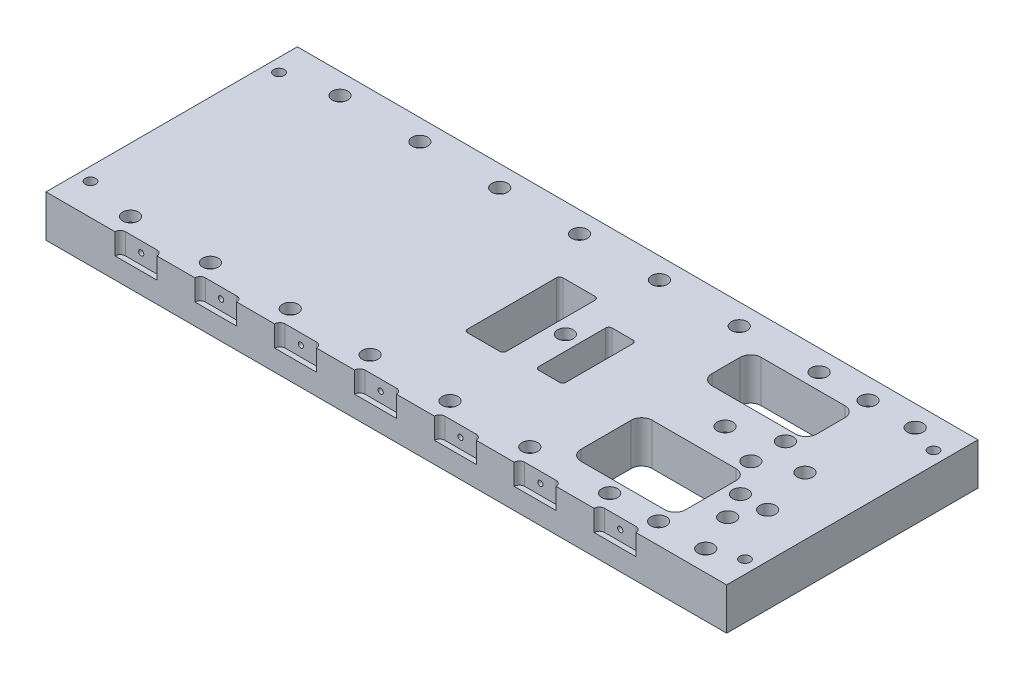
from build123d import *

# Parameters (mm, degrees)
SKETCH1_W                    = 650
SKETCH1_H                    = 240
BOSS_EXTRUDE1_DEPTH          = 40
CUT_EXTRUDE2_REACH           = 350.748
SKETCH3_R                    = 7.5
SKETCH4_R                    = 9
CUT_EXTRUDE3_DEPTH           = 5
SKETCH11_R                   = 7.5
CUT_EXTRUDE9_DEPTH           = 643.21019682
SKETCH12_R                   = 10
CUT_EXTRUDE10_DEPTH          = 5
SKETCH13_R                   = 10
CUT_EXTRUDE11_DEPTH          = 30
M10_TAPPED_HOLE1_D           = 8.5
M10_TAPPED_HOLE1_DEPTH       = 27.5
M10_TAPPED_HOLE1_CSINK_D     = 10.05
M10_TAPPED_HOLE1_CSINK_ANGLE = 90
M10_TAPPED_HOLE1_TIP         = 2.553657631
F_10_0MM_DOWEL_HOLE2_D       = 10
CUT_EXTRUDE12_REACH          = 350.748
SKETCH28_R                   = 7.5
SKETCH29_R                   = 9
CUT_EXTRUDE13_DEPTH          = 30
CUT_EXTRUDE14_DEPTH          = 20
LPATTERN1_COUNT              = 7
LPATTERN1_PITCH              = 76.25
CUT_EXTRUDE15_REACH          = 350.748
CUT_EXTRUDE16_REACH          = 350.748


with BuildPart() as part:
    # Sketch1 → Boss-Extrude1 (new body)
    with BuildSketch(Plane(origin=(0, 0, 0), x_dir=(1, 0, 0), z_dir=(0, 1, 0))):
        Rectangle(SKETCH1_W, SKETCH1_H)
    extrude(amount=-BOSS_EXTRUDE1_DEPTH)

    # Sketch3 → Cut-Extrude2 (cut, up to next)
    with BuildSketch(Plane(origin=(0, 0, 0), x_dir=(1, 0, 0), z_dir=(0, 1, 0)), mode=Mode.PRIVATE) as cut_extrude2_sk1:
        with Locations((234.38, 26.73)):
            Circle(SKETCH3_R)
    cut_extrude2_tool1 = extrude(cut_extrude2_sk1.sketch, amount=-CUT_EXTRUDE2_REACH, mode=Mode.PRIVATE) & part.part
    # Sketch3 → Cut-Extrude2 (cut, up to next)
    with BuildSketch(Plane(origin=(0, 0, 0), x_dir=(1, 0, 0), z_dir=(0, 1, 0)), mode=Mode.PRIVATE) as cut_extrude2_sk2:
        with Locations((234.38, -6.27)):
            Circle(SKETCH3_R)
    cut_extrude2_tool2 = extrude(cut_extrude2_sk2.sketch, amount=-CUT_EXTRUDE2_REACH, mode=Mode.PRIVATE) & part.part
    # Sketch3 → Cut-Extrude2 (cut, up to next)
    with BuildSketch(Plane(origin=(0, 0, 0), x_dir=(1, 0, 0), z_dir=(0, 1, 0)), mode=Mode.PRIVATE) as cut_extrude2_sk3:
        with Locations((269.5, -63.53)):
            Circle(SKETCH3_R)
    cut_extrude2_tool3 = extrude(cut_extrude2_sk3.sketch, amount=-CUT_EXTRUDE2_REACH, mode=Mode.PRIVATE) & part.part
    # Sketch3 → Cut-Extrude2 (cut, up to next)
    with BuildSketch(Plane(origin=(0, 0, 0), x_dir=(1, 0, 0), z_dir=(0, 1, 0)), mode=Mode.PRIVATE) as cut_extrude2_sk4:
        with Locations((282.5, -38.4)):
            Circle(SKETCH3_R)
    cut_extrude2_tool4 = extrude(cut_extrude2_sk4.sketch, amount=-CUT_EXTRUDE2_REACH, mode=Mode.PRIVATE) & part.part
    # Sketch3 → Cut-Extrude2 (cut, up to next)
    with BuildSketch(Plane(origin=(0, 0, 0), x_dir=(1, 0, 0), z_dir=(0, 1, 0)), mode=Mode.PRIVATE) as cut_extrude2_sk5:
        with Locations((256.5, -38.4)):
            Circle(SKETCH3_R)
    cut_extrude2_tool5 = extrude(cut_extrude2_sk5.sketch, amount=-CUT_EXTRUDE2_REACH, mode=Mode.PRIVATE) & part.part
    # Sketch3 → Cut-Extrude2 (cut, up to next)
    with BuildSketch(Plane(origin=(0, 0, 0), x_dir=(1, 0, 0), z_dir=(0, 1, 0)), mode=Mode.PRIVATE) as cut_extrude2_sk6:
        with BuildLine():
            Line((153.25, 84.63), (233.25, 84.63))
            ThreePointArc((233.25, 84.63), (240.321067812, 81.701067812), (243.25, 74.63))
            Line((243.25, 74.63), (243.25, 47.63))
            ThreePointArc((243.25, 47.63), (240.321067812, 40.558932188), (233.25, 37.63))
            Line((233.25, 37.63), (153.25, 37.63))
            ThreePointArc((153.25, 37.63), (146.178932188, 40.558932188), (143.25, 47.63))
            Line((143.25, 47.63), (143.25, 74.63))
            ThreePointArc((143.25, 74.63), (146.178932188, 81.701067812), (153.25, 84.63))
        make_face()
    cut_extrude2_tool6 = extrude(cut_extrude2_sk6.sketch, amount=-CUT_EXTRUDE2_REACH, mode=Mode.PRIVATE) & part.part
    # Sketch3 → Cut-Extrude2 (cut, up to next)
    with BuildSketch(Plane(origin=(0, 0, 0), x_dir=(1, 0, 0), z_dir=(0, 1, 0)), mode=Mode.PRIVATE) as cut_extrude2_sk7:
        with BuildLine():
            Line((153.25, -19.4), (233.25, -19.4))
            ThreePointArc((233.25, -19.4), (240.321067812, -22.328932188), (243.25, -29.4))
            Line((243.25, -29.4), (243.25, -77.4))
            ThreePointArc((243.25, -77.4), (240.321067812, -84.471067812), (233.25, -87.4))
            Line((233.25, -87.4), (153.25, -87.4))
            ThreePointArc((153.25, -87.4), (146.178932188, -84.471067812), (143.25, -77.4))
            Line((143.25, -77.4), (143.25, -29.4))
            ThreePointArc((143.25, -29.4), (146.178932188, -22.328932188), (153.25, -19.4))
        make_face()
    cut_extrude2_tool7 = extrude(cut_extrude2_sk7.sketch, amount=-CUT_EXTRUDE2_REACH, mode=Mode.PRIVATE) & part.part
    add(cut_extrude2_tool1.solids().sort_by_distance((234.38, 0, -26.73))[0], mode=Mode.SUBTRACT)
    add(cut_extrude2_tool2.solids().sort_by_distance((234.38, 0, 6.27))[0], mode=Mode.SUBTRACT)
    add(cut_extrude2_tool3.solids().sort_by_distance((269.5, 0, 63.53))[0], mode=Mode.SUBTRACT)
    add(cut_extrude2_tool4.solids().sort_by_distance((282.5, 0, 38.4))[0], mode=Mode.SUBTRACT)
    add(cut_extrude2_tool5.solids().sort_by_distance((256.5, 0, 38.4))[0], mode=Mode.SUBTRACT)
    add(cut_extrude2_tool6.solids().sort_by_distance((193.25, 0, -61.13))[0], mode=Mode.SUBTRACT)
    add(cut_extrude2_tool7.solids().sort_by_distance((193.25, 0, 53.4))[0], mode=Mode.SUBTRACT)

    # Sketch4 → Cut-Extrude3 (cut)
    with BuildSketch(Plane.XZ.offset(40)):
        with Locations((234.38, -26.73)):
            Circle(SKETCH4_R)
        with Locations((234.38, 6.27)):
            Circle(SKETCH4_R)
        with Locations((256.5, 38.4)):
            Circle(SKETCH4_R)
        with Locations((282.5, 38.4)):
            Circle(SKETCH4_R)
        with Locations((269.5, 63.53)):
            Circle(SKETCH4_R)
    extrude(amount=-CUT_EXTRUDE3_DEPTH, mode=Mode.SUBTRACT)

    # Sketch11 → Cut-Extrude9 (cut, through all)
    with BuildSketch(Plane(origin=(304.63, 0, 0), x_dir=(1, 0, 0), z_dir=(0, 1, 0))):
        with Locations((-35.13, 10.23)):
            Circle(SKETCH11_R)
        with Locations((-111.38, 10.23)):
            Circle(SKETCH11_R)
        with Locations((-263.88, 10.23)):
            Circle(SKETCH11_R)
    extrude(amount=-CUT_EXTRUDE9_DEPTH, mode=Mode.SUBTRACT)

    # Sketch12 → Cut-Extrude10 (cut)
    with BuildSketch(Plane(origin=(304.63, -40, 0), x_dir=(1, 0, 0), z_dir=(0, -1, 0))):
        with Locations((-35.13, -10.23)):
            Circle(SKETCH12_R)
    extrude(amount=-CUT_EXTRUDE10_DEPTH, mode=Mode.SUBTRACT)

    # Sketch13 → Cut-Extrude11 (cut)
    with BuildSketch(Plane(origin=(304.63, -40, 0), x_dir=(1, 0, 0), z_dir=(0, -1, 0))):
        with Locations((-111.38, -10.23)):
            Circle(SKETCH13_R)
        with Locations((-263.88, -10.23)):
            Circle(SKETCH13_R)
    extrude(amount=-CUT_EXTRUDE11_DEPTH, mode=Mode.SUBTRACT)

    # M10 Tapped Hole1
    with Locations(Plane(origin=(0, -40, 0), x_dir=(-1, 0, 0), z_dir=(0, -1, 0))):
        with Locations((-312.5, 107.5), (312.5, 107.5), (312.5, -107.5), (-312.5, -107.5)):
            CounterSinkHole(M10_TAPPED_HOLE1_D / 2, M10_TAPPED_HOLE1_CSINK_D / 2, depth=M10_TAPPED_HOLE1_DEPTH, counter_sink_angle=M10_TAPPED_HOLE1_CSINK_ANGLE)
            with Locations((0, 0, -(M10_TAPPED_HOLE1_DEPTH + M10_TAPPED_HOLE1_TIP / 2))):  # 118° drill point
                Cone(0, M10_TAPPED_HOLE1_D / 2, M10_TAPPED_HOLE1_TIP, mode=Mode.SUBTRACT)

    # Ø10.0mm Dowel Hole2 (through all)
    with Locations(Plane(origin=(0, -40, 0), x_dir=(-1, 0, 0), z_dir=(0, -1, 0))):
        with Locations((-312.5, 90), (312.5, 90), (312.5, -90), (-312.5, -90)):
            Hole(F_10_0MM_DOWEL_HOLE2_D / 2)

    # Sketch28 → Cut-Extrude12 (cut, up to next)
    with BuildSketch(Plane(origin=(0, 0, 0), x_dir=(1, 0, 0), z_dir=(0, 1, 0)), mode=Mode.PRIVATE) as cut_extrude12_sk1:
        with Locations((240, -100)):
            Circle(SKETCH28_R)
    cut_extrude12_tool1 = extrude(cut_extrude12_sk1.sketch, amount=-CUT_EXTRUDE12_REACH, mode=Mode.PRIVATE) & part.part
    # Sketch28 → Cut-Extrude12 (cut, up to next)
    with BuildSketch(Plane(origin=(0, 0, 0), x_dir=(1, 0, 0), z_dir=(0, 1, 0)), mode=Mode.PRIVATE) as cut_extrude12_sk2:
        with Locations((285, -100)):
            Circle(SKETCH28_R)
    cut_extrude12_tool2 = extrude(cut_extrude12_sk2.sketch, amount=-CUT_EXTRUDE12_REACH, mode=Mode.PRIVATE) & part.part
    # Sketch28 → Cut-Extrude12 (cut, up to next)
    with BuildSketch(Plane(origin=(0, 0, 0), x_dir=(1, 0, 0), z_dir=(0, 1, 0)), mode=Mode.PRIVATE) as cut_extrude12_sk3:
        with Locations((117, -100)):
            Circle(SKETCH28_R)
    cut_extrude12_tool3 = extrude(cut_extrude12_sk3.sketch, amount=-CUT_EXTRUDE12_REACH, mode=Mode.PRIVATE) & part.part
    # Sketch28 → Cut-Extrude12 (cut, up to next)
    with BuildSketch(Plane(origin=(0, 0, 0), x_dir=(1, 0, 0), z_dir=(0, 1, 0)), mode=Mode.PRIVATE) as cut_extrude12_sk4:
        with Locations((40.75, -100)):
            Circle(SKETCH28_R)
    cut_extrude12_tool4 = extrude(cut_extrude12_sk4.sketch, amount=-CUT_EXTRUDE12_REACH, mode=Mode.PRIVATE) & part.part
    # Sketch28 → Cut-Extrude12 (cut, up to next)
    with BuildSketch(Plane(origin=(0, 0, 0), x_dir=(1, 0, 0), z_dir=(0, 1, 0)), mode=Mode.PRIVATE) as cut_extrude12_sk5:
        with Locations((193.25, -100)):
            Circle(SKETCH28_R)
    cut_extrude12_tool5 = extrude(cut_extrude12_sk5.sketch, amount=-CUT_EXTRUDE12_REACH, mode=Mode.PRIVATE) & part.part
    # Sketch28 → Cut-Extrude12 (cut, up to next)
    with BuildSketch(Plane(origin=(0, 0, 0), x_dir=(1, 0, 0), z_dir=(0, 1, 0)), mode=Mode.PRIVATE) as cut_extrude12_sk6:
        with Locations((-35.5, -100)):
            Circle(SKETCH28_R)
    cut_extrude12_tool6 = extrude(cut_extrude12_sk6.sketch, amount=-CUT_EXTRUDE12_REACH, mode=Mode.PRIVATE) & part.part
    # Sketch28 → Cut-Extrude12 (cut, up to next)
    with BuildSketch(Plane(origin=(0, 0, 0), x_dir=(1, 0, 0), z_dir=(0, 1, 0)), mode=Mode.PRIVATE) as cut_extrude12_sk7:
        with Locations((-111.75, -100)):
            Circle(SKETCH28_R)
    cut_extrude12_tool7 = extrude(cut_extrude12_sk7.sketch, amount=-CUT_EXTRUDE12_REACH, mode=Mode.PRIVATE) & part.part
    # Sketch28 → Cut-Extrude12 (cut, up to next)
    with BuildSketch(Plane(origin=(0, 0, 0), x_dir=(1, 0, 0), z_dir=(0, 1, 0)), mode=Mode.PRIVATE) as cut_extrude12_sk8:
        with Locations((-188, -100)):
            Circle(SKETCH28_R)
    cut_extrude12_tool8 = extrude(cut_extrude12_sk8.sketch, amount=-CUT_EXTRUDE12_REACH, mode=Mode.PRIVATE) & part.part
    # Sketch28 → Cut-Extrude12 (cut, up to next)
    with BuildSketch(Plane(origin=(0, 0, 0), x_dir=(1, 0, 0), z_dir=(0, 1, 0)), mode=Mode.PRIVATE) as cut_extrude12_sk9:
        with Locations((-264.25, -100)):
            Circle(SKETCH28_R)
    cut_extrude12_tool9 = extrude(cut_extrude12_sk9.sketch, amount=-CUT_EXTRUDE12_REACH, mode=Mode.PRIVATE) & part.part
    cut_extrude12_1 = cut_extrude12_tool1.solids().sort_by_distance((240, 0, 100))[0]
    add(cut_extrude12_1, mode=Mode.SUBTRACT)
    cut_extrude12_2 = cut_extrude12_tool2.solids().sort_by_distance((285, 0, 100))[0]
    add(cut_extrude12_2, mode=Mode.SUBTRACT)
    cut_extrude12_3 = cut_extrude12_tool3.solids().sort_by_distance((117, 0, 100))[0]
    add(cut_extrude12_3, mode=Mode.SUBTRACT)
    cut_extrude12_4 = cut_extrude12_tool4.solids().sort_by_distance((40.75, 0, 100))[0]
    add(cut_extrude12_4, mode=Mode.SUBTRACT)
    cut_extrude12_5 = cut_extrude12_tool5.solids().sort_by_distance((193.25, 0, 100))[0]
    add(cut_extrude12_5, mode=Mode.SUBTRACT)
    cut_extrude12_6 = cut_extrude12_tool6.solids().sort_by_distance((-35.5, 0, 100))[0]
    add(cut_extrude12_6, mode=Mode.SUBTRACT)
    cut_extrude12_7 = cut_extrude12_tool7.solids().sort_by_distance((-111.75, 0, 100))[0]
    add(cut_extrude12_7, mode=Mode.SUBTRACT)
    cut_extrude12_8 = cut_extrude12_tool8.solids().sort_by_distance((-188, 0, 100))[0]
    add(cut_extrude12_8, mode=Mode.SUBTRACT)
    cut_extrude12_9 = cut_extrude12_tool9.solids().sort_by_distance((-264.25, 0, 100))[0]
    add(cut_extrude12_9, mode=Mode.SUBTRACT)
    cut_extrude12 = cut_extrude12_1 + cut_extrude12_2 + cut_extrude12_3 + cut_extrude12_4 + cut_extrude12_5 + cut_extrude12_6 + cut_extrude12_7 + cut_extrude12_8 + cut_extrude12_9  # Cut-Extrude12 as one shape, for the pattern or mirror that repeats it

    # Mirror1: Cut-Extrude12 across plane
    add(cut_extrude12.mirror(Plane.XY), mode=Mode.SUBTRACT)

    # Sketch29 → Cut-Extrude13 (cut)
    with BuildSketch(Plane.XZ.offset(40)):
        with Locations((193.25, 100)):
            Circle(SKETCH29_R)
        with Locations((240, 100)):
            Circle(SKETCH29_R)
        with Locations((240, -100)):
            Circle(SKETCH29_R)
        with Locations((193.25, -100)):
            Circle(SKETCH29_R)
        with Locations((285, 100)):
            Circle(SKETCH29_R)
        with Locations((285, -100)):
            Circle(SKETCH29_R)
        with Locations((117, 100)):
            Circle(SKETCH29_R)
        with Locations((117, -100)):
            Circle(SKETCH29_R)
        with Locations((40.75, 100)):
            Circle(SKETCH29_R)
        with Locations((40.75, -100)):
            Circle(SKETCH29_R)
        with Locations((-35.5, 100)):
            Circle(SKETCH29_R)
        with Locations((-35.5, -100)):
            Circle(SKETCH29_R)
        with Locations((-111.75, 100)):
            Circle(SKETCH29_R)
        with Locations((-111.75, -100)):
            Circle(SKETCH29_R)
        with Locations((-188, 100)):
            Circle(SKETCH29_R)
        with Locations((-188, -100)):
            Circle(SKETCH29_R)
        with Locations((-264.25, 100)):
            Circle(SKETCH29_R)
        with Locations((-264.25, -100)):
            Circle(SKETCH29_R)
    extrude(amount=-CUT_EXTRUDE13_DEPTH, mode=Mode.SUBTRACT)

    # Sketch30 → Cut-Extrude14 (cut)
    with BuildSketch(Plane(origin=(304.63, 0, 0), x_dir=(1, 0, 0), z_dir=(0, 1, 0))):
        with BuildLine():
            Line((-106.25, -120), (-66.25, -120))
            ThreePointArc((-66.25, -120), (-67.714466094, -116.464466094), (-71.25, -115))
            Line((-71.25, -115), (-101.25, -115))
            ThreePointArc((-101.25, -115), (-104.785533906, -116.464466094), (-106.25, -120))
        make_face()
    cut_extrude14 = extrude(amount=-CUT_EXTRUDE14_DEPTH, mode=Mode.SUBTRACT)

    # Sketch32 → M6 Tapped Hole1 (revolve, cut)
    with BuildSketch(Plane(origin=(218.38, -10, 115), x_dir=(0, -1, 0), z_dir=(1, 0, 0))):
        Polygon((0, 0), (0, 11.502151548), (2.5, 10), (2.5, 0), align=None)
    m6_tapped_hole1 = revolve(axis=Axis((218.38, -10, 121.35), (0, 0, -1)), mode=Mode.SUBTRACT)

    # LPattern1: Cut-Extrude14, M6 Tapped Hole1 ×7
    with Locations(*[(-i * LPATTERN1_PITCH, 0, 0) for i in range(1, LPATTERN1_COUNT)]):
        add(cut_extrude14, mode=Mode.SUBTRACT)
        add(m6_tapped_hole1, mode=Mode.SUBTRACT)

    # Sketch38 → Cut-Extrude15 (cut, up to next)
    with BuildSketch(Plane(origin=(0, 0, 0), x_dir=(1, 0, 0), z_dir=(0, 1, 0)), mode=Mode.PRIVATE) as cut_extrude15_sk1:
        with BuildLine():
            Line((57.75, -32.27), (77.75, -32.27))
            ThreePointArc((77.75, -32.27), (79.871320344, -31.391320344), (80.75, -29.27))
            Line((80.75, -29.27), (80.75, 34.73))
            ThreePointArc((80.75, 34.73), (79.871320344, 36.851320344), (77.75, 37.73))
            Line((77.75, 37.73), (57.75, 37.73))
            ThreePointArc((57.75, 37.73), (55.628679656, 36.851320344), (54.75, 34.73))
            Line((54.75, 34.73), (54.75, -29.27))
            ThreePointArc((54.75, -29.27), (55.628679656, -31.391320344), (57.75, -32.27))
        make_face()
    cut_extrude15_tool1 = extrude(cut_extrude15_sk1.sketch, amount=-CUT_EXTRUDE15_REACH, mode=Mode.PRIVATE) & part.part
    add(cut_extrude15_tool1.solids().sort_by_distance((67.75, 0, -2.73))[0], mode=Mode.SUBTRACT)

    # Sketch39 → Cut-Extrude16 (cut, up to next)
    with BuildSketch(Plane(origin=(0, 0, 0), x_dir=(1, 0, 0), z_dir=(0, 1, 0)), mode=Mode.PRIVATE) as cut_extrude16_sk1:
        with BuildLine():
            Line((-7.25, -35.27), (23.75, -35.27))
            ThreePointArc((23.75, -35.27), (25.871320344, -34.391320344), (26.75, -32.27))
            Line((26.75, -32.27), (26.75, 52.73))
            ThreePointArc((26.75, 52.73), (25.871320344, 54.851320344), (23.75, 55.73))
            Line((23.75, 55.73), (-7.25, 55.73))
            ThreePointArc((-7.25, 55.73), (-9.371320344, 54.851320344), (-10.25, 52.73))
            Line((-10.25, 52.73), (-10.25, -32.27))
            ThreePointArc((-10.25, -32.27), (-9.371320344, -34.391320344), (-7.25, -35.27))
        make_face()
    cut_extrude16_tool1 = extrude(cut_extrude16_sk1.sketch, amount=-CUT_EXTRUDE16_REACH, mode=Mode.PRIVATE) & part.part
    add(cut_extrude16_tool1.solids().sort_by_distance((8.25, 0, -10.23))[0], mode=Mode.SUBTRACT)


solid = part.part
